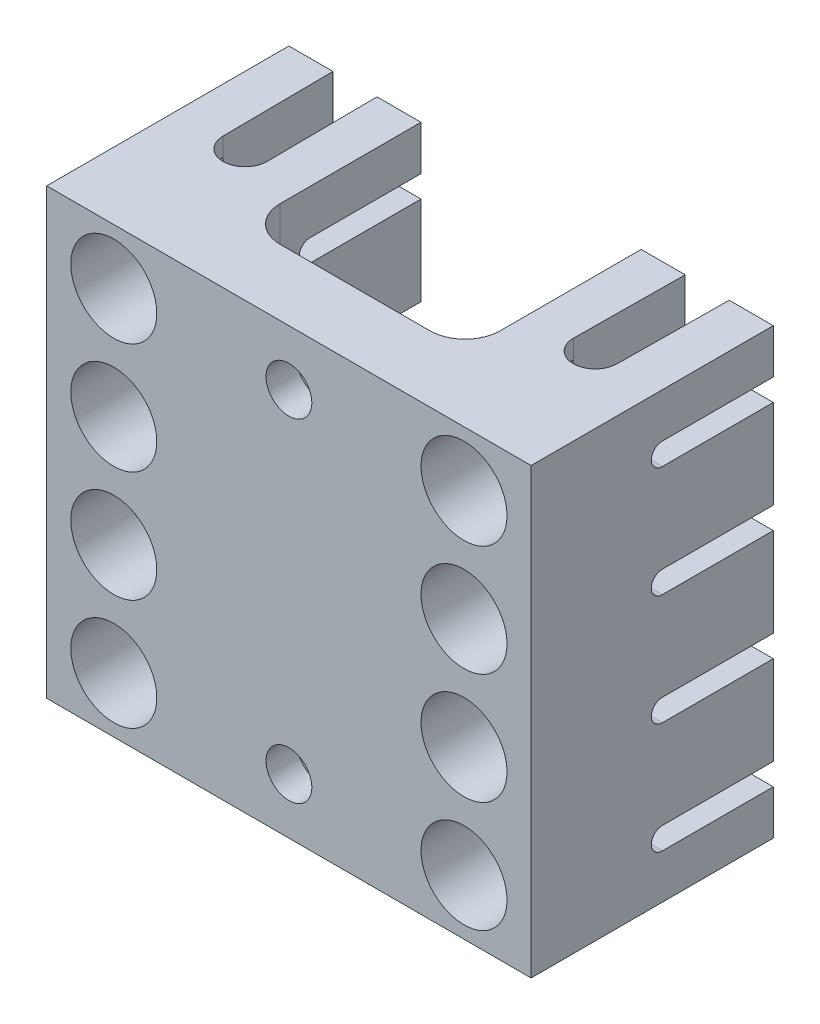
from build123d import *

# Parameters (mm, degrees)
BOSS_EXTRUDE1_START = -4
BOSS_EXTRUDE1_DEPTH = 8
CUT_EXTRUDE1_START  = -8
SKETCH2_R           = 3.1
CUT_EXTRUDE1_DEPTH  = 18.01755009
CUT_EXTRUDE2_DEPTH  = 22.959710978
FILLET1_R           = 2.54
CUT_EXTRUDE6_DEPTH  = 24.026699932
LPATTERN1_COUNT     = 4
LPATTERN1_PITCH     = 8
SKETCH4_R           = 1.651
CUT_EXTRUDE3_DEPTH  = 36.358576263
SKETCH5_R           = 3.175
CUT_EXTRUDE4_DEPTH  = 2.54


# Read off the part's stored shape, not the designer's step: Boss-Extrude1
with BuildPart() as part:
    # Boss-Extrude1 outline → Boss-Extrude1 (new body)
    with BuildSketch(Plane(origin=(0, 0, 0), x_dir=(1, 0, 0), z_dir=(0, 1, 0)).offset(BOSS_EXTRUDE1_START)):
        Polygon((0, -4.7625), (0, 0), (-7.9375, 0), (-7.9375, 12.7), (-17.4625, 12.7), (-17.4625, -4.7625), align=None)
    extrude(amount=BOSS_EXTRUDE1_DEPTH)

    # Sketch2 → Cut-Extrude1 (cut, through all)
    with BuildSketch(Plane(origin=(0, 0, -12.7), x_dir=(-1, 0, 0), z_dir=(0, 0, -1)).offset(CUT_EXTRUDE1_START)):
        with Locations((12.625, 0)):
            Circle(SKETCH2_R)
    extrude(amount=-CUT_EXTRUDE1_DEPTH, mode=Mode.SUBTRACT)

    # Sketch3 → Cut-Extrude2 (cut, through all)
    with BuildSketch(Plane.ZY.offset(17.4625)):
        with BuildLine():
            Line((-12.7, 0.79375), (-4.7, 0.79375))
            ThreePointArc((-4.7, 0.79375), (-3.90625, 0), (-4.7, -0.79375))
            Line((-4.7, -0.79375), (-12.7, -0.79375))
            ThreePointArc((-12.7, -0.79375), (-13.49375, 0), (-12.7, 0.79375))
        make_face()
    extrude(amount=-CUT_EXTRUDE2_DEPTH, mode=Mode.SUBTRACT)

    # Fillet1
    fillet1_edges = [part.edges().sort_by_distance(p)[0] for p in [
        (-7.9375, 0, 0),
    ]]
    fillet(fillet1_edges, radius=FILLET1_R)

    # Sketch8 → Cut-Extrude6 (cut, through all)
    with BuildSketch(Plane(origin=(0, 4, 0), x_dir=(1, 0, 0), z_dir=(0, 1, 0))):
        with BuildLine():
            Line((-11.112569759, 12.714882159), (-11.037569759, 4.714882159))
            ThreePointArc((-11.037569759, 4.714882159), (-12.610117841, 3.112569759), (-14.212430241, 4.685117841))
            Line((-14.212430241, 4.685117841), (-14.287430241, 12.685117841))
            ThreePointArc((-14.287430241, 12.685117841), (-12.714882159, 14.287430241), (-11.112569759, 12.714882159))
        make_face()
    extrude(amount=-CUT_EXTRUDE6_DEPTH, mode=Mode.SUBTRACT)

    # Mirror1: part across plane


with BuildPart() as part_1:
    add(part.part)
    add(part.part.mirror(Plane(origin=(0, 4, 0), x_dir=(0, 0, 1), z_dir=(-1, 0, 0))))


with BuildPart() as lpattern1_1:
    # LPattern1: pattern copy
    add(part_1.part.moved(Location(Vector(0, -1, 0) * (1 * LPATTERN1_PITCH))))


with BuildPart() as lpattern1_2:
    # LPattern1: pattern copy
    add(part_1.part.moved(Location(Vector(0, -1, 0) * (2 * LPATTERN1_PITCH))))


with BuildPart() as lpattern1_3:
    # LPattern1: pattern copy
    add(part_1.part.moved(Location(Vector(0, -1, 0) * (3 * LPATTERN1_PITCH))))


with BuildPart() as part_2:
    add(part_1.part)

    # Combine1: union LPattern1_1, LPattern1_2, LPattern1_3
    add(lpattern1_1.part)
    add(lpattern1_2.part)
    add(lpattern1_3.part)

    # Sketch4 → Cut-Extrude3 (cut, through all)
    with BuildSketch(Plane(origin=(0, 0, 0), x_dir=(-1, 0, 0), z_dir=(0, 0, -1))):
        Circle(SKETCH4_R)
        with Locations((0, -24)):
            Circle(SKETCH4_R)
    extrude(amount=-CUT_EXTRUDE3_DEPTH, mode=Mode.SUBTRACT)

    # Sketch5 → Cut-Extrude4 (cut)
    with BuildSketch(Plane(origin=(0, 0, 0), x_dir=(-1, 0, 0), z_dir=(0, 0, -1))):
        Circle(SKETCH5_R)
        with Locations((0, -24)):
            Circle(SKETCH5_R)
    extrude(amount=-CUT_EXTRUDE4_DEPTH, mode=Mode.SUBTRACT)


solid = part_2.part
